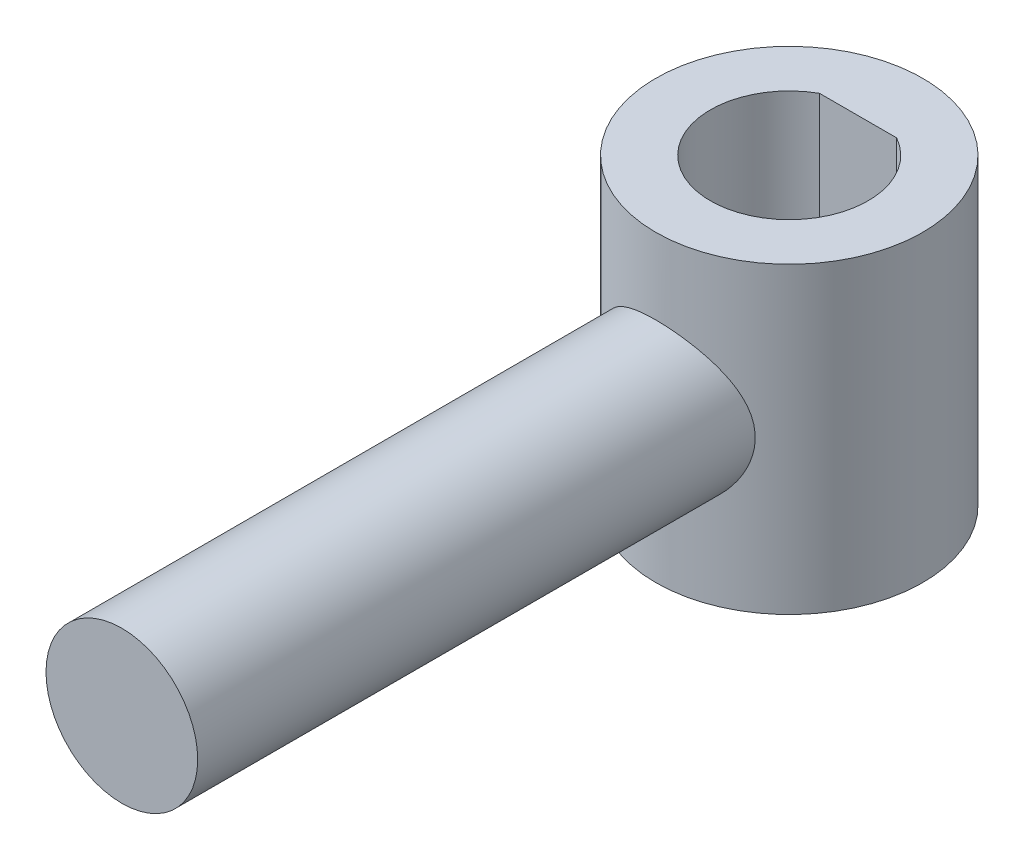
from build123d import *

# Parameters (mm, degrees)
SKETCH2_R               = 6.25
BOSS_EXTRUDE3_DEPTH     = 55
SKETCH1_R               = 11
BOSS_EXTRUDE4_DEPTH     = 12.5
CUT_EXTRUDE1_DEPTH      = 58.465207001
CUT_EXTRUDE1_DEPTH_BACK = 58.465207001
CUT_EXTRUDE2_DEPTH      = 2.35


with BuildPart() as part:
    # Sketch2 → Boss-Extrude3 (new body)
    with BuildSketch(Plane.XY):
        Circle(SKETCH2_R)
    extrude(amount=BOSS_EXTRUDE3_DEPTH)

    # Sketch1 → Boss-Extrude4 (add, symmetric)
    with BuildSketch(Plane(origin=(0, 0, 0), x_dir=(1, 0, 0), z_dir=(0, 1, 0))):
        Circle(SKETCH1_R)
    extrude(amount=BOSS_EXTRUDE4_DEPTH, both=True)

    # Sketch1<4> → Cut-Extrude1 (cut, two sides: drawn at the far end of the back side and taken through both)
    with BuildSketch(Plane(origin=(0, 0, 0), x_dir=(1, 0, 0), z_dir=(0, 1, 0)).offset(-CUT_EXTRUDE1_DEPTH_BACK)):
        with BuildLine():
            Line((3.175, 5.671805268), (-3.175, 5.671805268))
            ThreePointArc((-3.175, 5.671805268), (0, -6.5), (3.175, 5.671805268))
        make_face()
    extrude(amount=CUT_EXTRUDE1_DEPTH + CUT_EXTRUDE1_DEPTH_BACK, mode=Mode.SUBTRACT)

    # Sketch3 → Cut-Extrude2 (cut, symmetric)
    with BuildSketch(Plane.XY.offset(45)):
        with BuildLine():
            Line((-3.175, -5.38348168), (3.175, -5.38348168))
            ThreePointArc((3.175, -5.38348168), (0, -6.25), (-3.175, -5.38348168))
        make_face()
    extrude(amount=CUT_EXTRUDE2_DEPTH, both=True, mode=Mode.SUBTRACT)


solid = part.part
